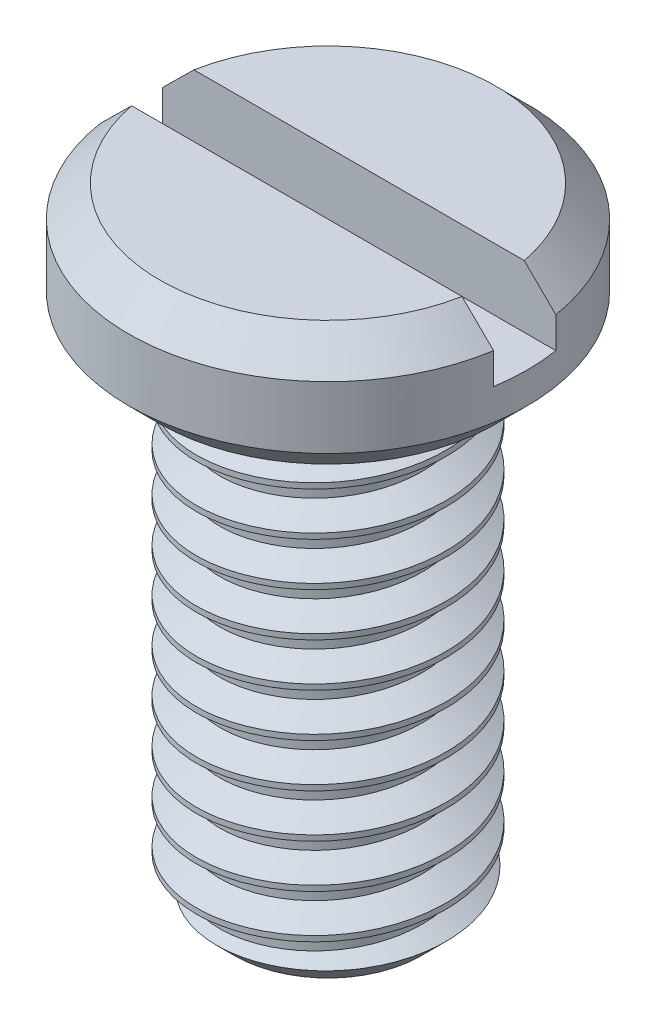
from build123d import *

# Parameters (mm, degrees)
SKETCH1_R           = 2
BOSS_EXTRUDE1_DEPTH = 8
CHAMFER1_SIZE       = 0.5
THREAD1_PITCH       = 0.7
SKETCH4_R           = 3.2
BOSS_EXTRUDE2_DEPTH = 2
CHAMFER2_SIZE       = 0.5
SKETCH5_W           = 7.081781444
SKETCH5_H           = 1
CUT_EXTRUDE1_DEPTH  = 1


with BuildPart() as part:
    # Sketch1 → Boss-Extrude1 (new body)
    with BuildSketch(Plane(origin=(0, 0, 0), x_dir=(1, 0, 0), z_dir=(0, 1, 0))):
        with Locations(Location((0, 0, 0), (0, 0, 270))):
            Circle(SKETCH1_R)
    extrude(amount=BOSS_EXTRUDE1_DEPTH)

    # Chamfer1
    chamfer1_edges = [part.edges().sort_by_distance(p)[0] for p in [
        (0, 0, -2),
    ]]
    chamfer(chamfer1_edges, length=CHAMFER1_SIZE)

    # Thread1: the profile of Thread Profile1 profile screwed along a right-hand helix of 14.285714 turns, 6 arcs to a turn; built about Z, then put on its axis
    thread1_z = Axis((0, 0, 0), (0, 0, 1))
    thread1_corners = [(2.0003, 0, -0.000173205), (2.0003, 0, 0.612673203), (1.621113887, 0, 0.393749999), (1.621113887, 0, 0.218749999)]
    with BuildLine(mode=Mode.PRIVATE) as thread1_profile:
        Line(thread1_corners[0], thread1_corners[1])
        Line(thread1_corners[1], thread1_corners[2])
        Line(thread1_corners[2], thread1_corners[3])
        Line(thread1_corners[3], thread1_corners[0])
    thread1_cap = Face(thread1_profile.wire())
    thread1_turn_angles = [0, 30, 60, 90, 120, 150, 180, 210, 240, 270, 300, 330, 360]
    thread1_turn_weights = [1, 0.8660254037844387, 1, 0.8660254037844387, 1, 0.8660254037844387, 1, 0.8660254037844387, 1, 0.8660254037844387, 1, 0.8660254037844387, 1]
    thread1_turn_rails = [Edge.make_bspline([Vector(p[0], p[1], 0).rotate(thread1_z, thread1_turn_angles[k]) / thread1_turn_weights[k] + Vector(0, 0, p[2] + THREAD1_PITCH * thread1_turn_angles[k] / 360) for k in range(13)], [0, 0, 0, 1, 1, 2, 2, 3, 3, 4, 4, 5, 5, 6, 6, 6], 2, thread1_turn_weights) for p in thread1_corners]
    thread1_turn_sides = [Face.make_surface_from_curves(thread1_turn_rails[p[0]], thread1_turn_rails[p[1]]) for p in [(0, 1), (1, 2), (2, 3), (3, 0)]]
    thread1_last_angles = [5040, 5070, 5100, 5121.428571429, 5142.857142857]
    thread1_last_weights = [1, 0.8660254037844387, 1, 0.9308737486442035, 1]
    thread1_last_rails = [Edge.make_bspline([Vector(p[0], p[1], 0).rotate(thread1_z, thread1_last_angles[k]) / thread1_last_weights[k] + Vector(0, 0, p[2] + THREAD1_PITCH * thread1_last_angles[k] / 360) for k in range(5)], [0, 0, 0, 1, 1, 2, 2, 2], 2, thread1_last_weights) for p in thread1_corners]
    thread1_last_sides = [Face.make_surface_from_curves(thread1_last_rails[p[0]], thread1_last_rails[p[1]]) for p in [(0, 1), (1, 2), (2, 3), (3, 0)]]
    thread1 = Plane(origin=(0, 9, 0), x_dir=(-1, 0, 0), z_dir=(0, -1, 0)) * Solid(Shell([*[p.moved(Location((0, 0, THREAD1_PITCH * i))) for i in range(14) for p in thread1_turn_sides], *thread1_last_sides, thread1_cap, thread1_cap.rotate(thread1_z, 5142.857142857).moved(Location((0, 0, THREAD1_PITCH * 5142.857142857 / 360)))]))
    add(thread1, mode=Mode.SUBTRACT)

    # Sketch4 → Boss-Extrude2 (add)
    with BuildSketch(Plane(origin=(0, 8, 0), x_dir=(1, 0, 0), z_dir=(0, 1, 0))):
        with Locations(Location((0, 0, 0), (0, 0, 270))):
            Circle(SKETCH4_R)
    extrude(amount=BOSS_EXTRUDE2_DEPTH)

    # Chamfer2
    chamfer2_edges = [part.edges().sort_by_distance(p)[0] for p in [
        (0, 8, -3.2),
        (0, 10, -3.2),
    ]]
    chamfer(chamfer2_edges, length=CHAMFER2_SIZE)

    # Sketch5 → Cut-Extrude1 (cut)
    with BuildSketch(Plane(origin=(0, 10, 0), x_dir=(1, 0, 0), z_dir=(0, 1, 0))):
        Rectangle(SKETCH5_W, SKETCH5_H)
    extrude(amount=-CUT_EXTRUDE1_DEPTH, mode=Mode.SUBTRACT)


solid = part.part
